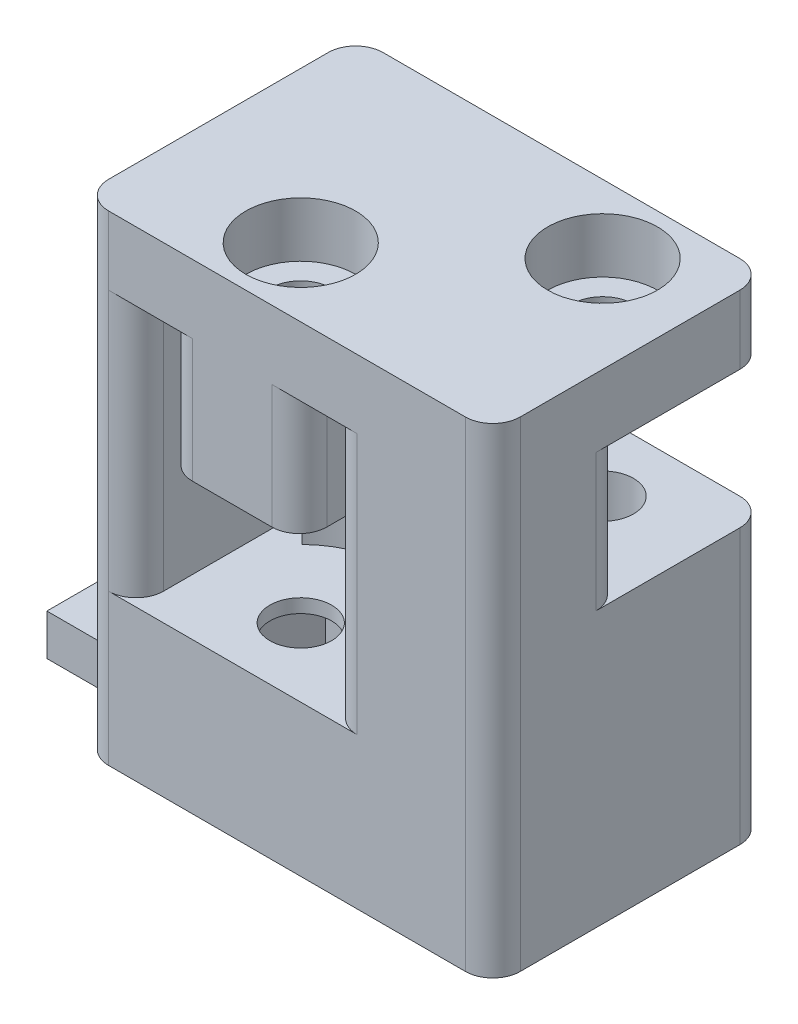
from build123d import *

# Parameters (mm, degrees)
SKETCH1_W                                           = 30
SKETCH1_H                                           = 20
BOSS_EXTRUDE1_DEPTH                                 = 11
SKETCH2_W                                           = 4
SKETCH2_H                                           = 20
BOSS_EXTRUDE2_DEPTH                                 = 19
SKETCH3_W                                           = 30
SKETCH3_H                                           = 20
BOSS_EXTRUDE3_DEPTH                                 = 5
BOSS_EXTRUDE4_START                                 = 9
BOSS_EXTRUDE4_DEPTH                                 = 9
BOSS_EXTRUDE5_DEPTH                                 = 9
BOSS_EXTRUDE6_DEPTH                                 = 1
FILLET1_R                                           = 2
SKETCH7_R                                           = 2.25
CUT_EXTRUDE1_DEPTH                                  = 40.37003937
CBORE_FOR_M4_HEX_SOCKET_HEAD_CAP_SCREW2_D           = 4.5
CBORE_FOR_M4_HEX_SOCKET_HEAD_CAP_SCREW2_CBORE_D     = 8
CBORE_FOR_M4_HEX_SOCKET_HEAD_CAP_SCREW2_CBORE_DEPTH = 4
CUT_EXTRUDE4_DEPTH                                  = 10
SKETCH23_W                                          = 11
SKETCH23_H                                          = 3
BOSS_EXTRUDE10_DEPTH                                = 7
SKETCH24_R                                          = 1.75
CUT_EXTRUDE7_DEPTH                                  = 7
SKETCH25_R                                          = 3
CUT_EXTRUDE8_DEPTH                                  = 1
FILLET2_R                                           = 2


with BuildPart() as part:
    # Sketch1 → Boss-Extrude1 (new body)
    with BuildSketch(Plane(origin=(0, 0, 0), x_dir=(1, 0, 0), z_dir=(0, 1, 0))):
        Rectangle(SKETCH1_W, SKETCH1_H)
    extrude(amount=BOSS_EXTRUDE1_DEPTH)

    # Sketch2 → Boss-Extrude2 (add)
    with BuildSketch(Plane(origin=(0, 11, 0), x_dir=(1, 0, 0), z_dir=(0, 1, 0))):
        with Locations((-13, 0)):
            Rectangle(SKETCH2_W, SKETCH2_H)
        with BuildLine():
            Line((0.898979486, 10), (-8.898979486, 10))
            Line((-8.898979486, 10), (-8.898979486, 0))
            ThreePointArc((-8.898979486, 0), (-4, 2), (0.898979486, 0))
            Line((0.898979486, 0), (0.898979486, 10))
        make_face()
        with BuildLine():
            Line((3.101020514, 0), (3.101020514, -10))
            Line((3.101020514, -10), (15, -10))
            Line((15, -10), (15, 5))
            ThreePointArc((15, 5), (10.711747002, -1.453404388), (3.101020514, 0))
        make_face()
    extrude(amount=BOSS_EXTRUDE2_DEPTH)

    # Sketch3 → Boss-Extrude3 (add)
    with BuildSketch(Plane(origin=(0, 30, 0), x_dir=(1, 0, 0), z_dir=(0, 1, 0))):
        Rectangle(SKETCH3_W, SKETCH3_H)
    extrude(amount=BOSS_EXTRUDE3_DEPTH)

    # Sketch4 → Boss-Extrude4 (add)
    with BuildSketch(Plane.XZ.offset(-30).offset(BOSS_EXTRUDE4_START)):
        with BuildLine():
            Line((-8.898979486, 0), (-8.898979486, 10))
            Line((-8.898979486, 10), (0.898979486, 10))
            Line((0.898979486, 10), (0.898979486, 0))
            ThreePointArc((0.898979486, 0), (-4, -2), (-8.898979486, 0))
        make_face()
    extrude(amount=-BOSS_EXTRUDE4_DEPTH)

    # Sketch5 → Boss-Extrude5 (add)
    with BuildSketch(Plane(origin=(0, 11, 0), x_dir=(1, 0, 0), z_dir=(0, 1, 0))):
        with BuildLine():
            Line((15, 10), (15, 5))
            ThreePointArc((15, 5), (10.711747002, -1.453404388), (3.101020514, 0))
            Line((3.101020514, 0), (3.101020514, -5.240408206))
            ThreePointArc((3.101020514, -5.240408206), (2.528143689, -2.398275958), (0.898979486, 0))
            Line((0.898979486, 0), (0.898979486, 10))
            Line((0.898979486, 10), (15, 10))
        make_face()
    extrude(amount=BOSS_EXTRUDE5_DEPTH)

    # Sketch6 → Boss-Extrude6 (add)
    with BuildSketch(Plane(origin=(0, 20, 0), x_dir=(1, 0, 0), z_dir=(0, 1, 0))):
        with BuildLine():
            Line((3.101020514, 0), (3.101020514, -5.240408206))
            ThreePointArc((3.101020514, -5.240408206), (2.528143689, -2.398275958), (0.898979486, 0))
            Line((0.898979486, 0), (0.898979486, 5.240408206))
            ThreePointArc((0.898979486, 5.240408206), (1.471856311, 2.398275958), (3.101020514, 0))
        make_face()
    extrude(amount=BOSS_EXTRUDE6_DEPTH)

    # Fillet1
    fillet1_edges = [part.edges().sort_by_distance(p)[0] for p in [
        (-11, 20.5, 10),
        (-11, 20.5, -10),
        (0.898979486, 25, -10),
        (-8.898979486, 20.5, -10),
        (15, 25, -5),
        (3.101020514, 20.5, 10),
        (0.898979486, 25.5, 10),
        (-8.898979486, 25.5, 10),
    ]]
    fillet(fillet1_edges, radius=FILLET1_R)

    # Sketch7 → Cut-Extrude1 (cut, through all)
    with BuildSketch(Plane(origin=(0, 35, 0), x_dir=(1, 0, 0), z_dir=(0, 1, 0))):
        with Locations(Location((-4, -5, 0), (0, 0, 270))):
            Circle(SKETCH7_R)
        with Locations(Location((8, 5, 0), (0, 0, 270))):
            Circle(SKETCH7_R)
    extrude(amount=-CUT_EXTRUDE1_DEPTH, mode=Mode.SUBTRACT)

    # CBORE for M4 Hex Socket Head Cap Screw2 (through all)
    with Locations(Plane(origin=(0, 35, 0), x_dir=(1, 0, 0), z_dir=(0, 1, 0))):
        with Locations((-4, -5), (8, 5)):
            CounterBoreHole(CBORE_FOR_M4_HEX_SOCKET_HEAD_CAP_SCREW2_D / 2, CBORE_FOR_M4_HEX_SOCKET_HEAD_CAP_SCREW2_CBORE_D / 2, CBORE_FOR_M4_HEX_SOCKET_HEAD_CAP_SCREW2_CBORE_DEPTH)

    # Sketch12 → Cut-Extrude4 (cut)
    with BuildSketch(Plane.XZ):
        Polygon((0.907477288, 5), (-1.546261356, 9.25), (-6.453738644, 9.25), (-8.907477288, 5), (-6.453738644, 0.75), (-1.546261356, 0.75), align=None)
        Polygon((3.092522712, -5), (5.546261356, -9.25), (10.453738644, -9.25), (12.907477288, -5), (10.453738644, -0.75), (5.546261356, -0.75), align=None)
    extrude(amount=-CUT_EXTRUDE4_DEPTH, mode=Mode.SUBTRACT)

    # Sketch23 → Boss-Extrude10 (add)
    with BuildSketch(Plane.ZY.offset(15)):
        with Locations((0, 1.5)):
            Rectangle(SKETCH23_W, SKETCH23_H)
    extrude(amount=BOSS_EXTRUDE10_DEPTH)

    # Sketch24 → Cut-Extrude7 (cut)
    with BuildSketch(Plane(origin=(0, 3, 0), x_dir=(1, 0, 0), z_dir=(0, 1, 0))):
        with Locations(Location((-18.5, 0, 0), (0, 0, 270))):
            Circle(SKETCH24_R)
    extrude(amount=-CUT_EXTRUDE7_DEPTH, mode=Mode.SUBTRACT)

    # Sketch25 → Cut-Extrude8 (cut)
    with BuildSketch(Plane(origin=(0, 3, 0), x_dir=(1, 0, 0), z_dir=(0, 1, 0))):
        with Locations(Location((-18.5, 0, 0), (0, 0, 270))):
            Circle(SKETCH25_R)
    extrude(amount=-CUT_EXTRUDE8_DEPTH, mode=Mode.SUBTRACT)

    # Fillet2
    fillet2_edges = [part.edges().sort_by_distance(p)[0] for p in [
        (15, 32.5, -10),
        (15, 17.5, 10),
        (-15, 17.5, 10),
        (-15, 17.5, -10),
        (15, 10, -10),
    ]]
    fillet(fillet2_edges, radius=FILLET2_R - 0.0001)  # a hair under: the kernel refuses the full size


solid = part.part
